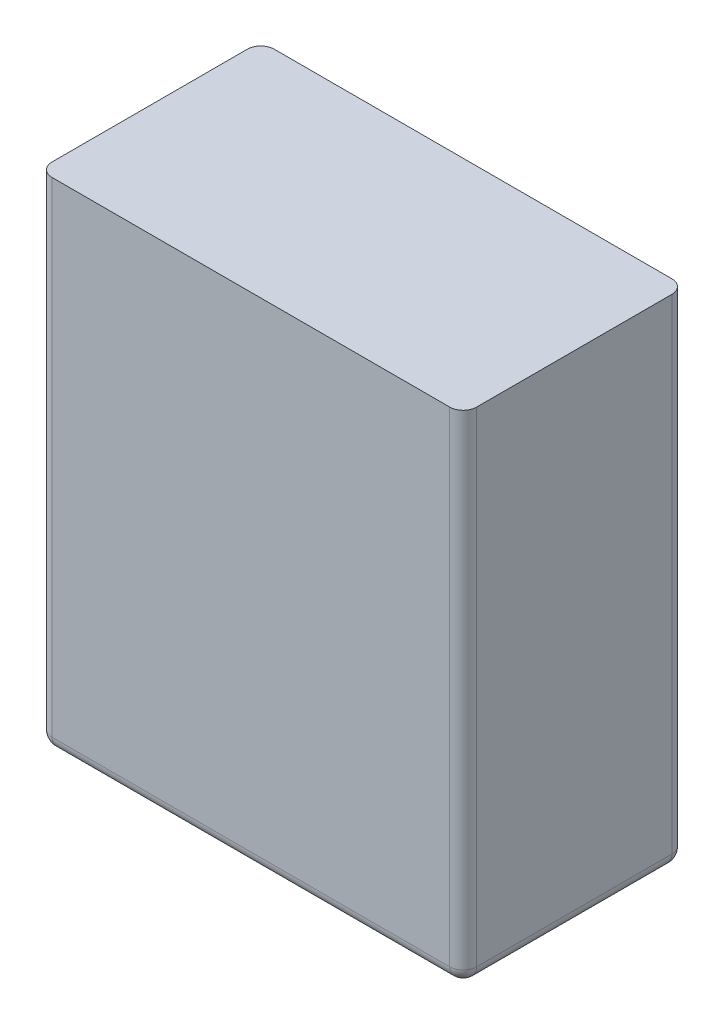
from build123d import *

# Parameters (mm, degrees)
CROQUIS1_W              = 31.53
CROQUIS1_H              = 74
SALIENTE_EXTRUIR1_DEPTH = 16.5
REDONDEO2_R             = 1
CROQUIS2_W              = 31.612590528
CROQUIS2_H              = 37.215809172
CORTAR_EXTRUIR1_DEPTH   = 44.471660021


with BuildPart() as part:
    # Croquis1 → Saliente-Extruir1 (new body)
    with BuildSketch(Plane.XY):
        Rectangle(CROQUIS1_W, CROQUIS1_H)
    extrude(amount=SALIENTE_EXTRUIR1_DEPTH)

    # Redondeo2
    redondeo2_edges = [part.edges().sort_by_distance(p)[0] for p in [
        (-15.765, -37, 8.25),
        (0, -37, 0),
        (0, 37, 0),
        (-15.765, 0, 0),
        (15.765, 0, 0),
        (15.765, -37, 8.25),
        (0, -37, 16.5),
        (-15.765, 0, 16.5),
        (15.765, 0, 16.5),
        (15.765, 37, 8.25),
        (0, 37, 16.5),
        (-15.765, 37, 8.25),
    ]]
    fillet(redondeo2_edges, radius=REDONDEO2_R)

    # Croquis2 → Cortar-Extruir1 (cut, through all)
    with BuildSketch(Plane.XY.offset(16.5)):
        with Locations((-0.041295264, 18.607904586)):
            Rectangle(CROQUIS2_W, CROQUIS2_H)
    extrude(amount=-CORTAR_EXTRUIR1_DEPTH, mode=Mode.SUBTRACT)


solid = part.part
